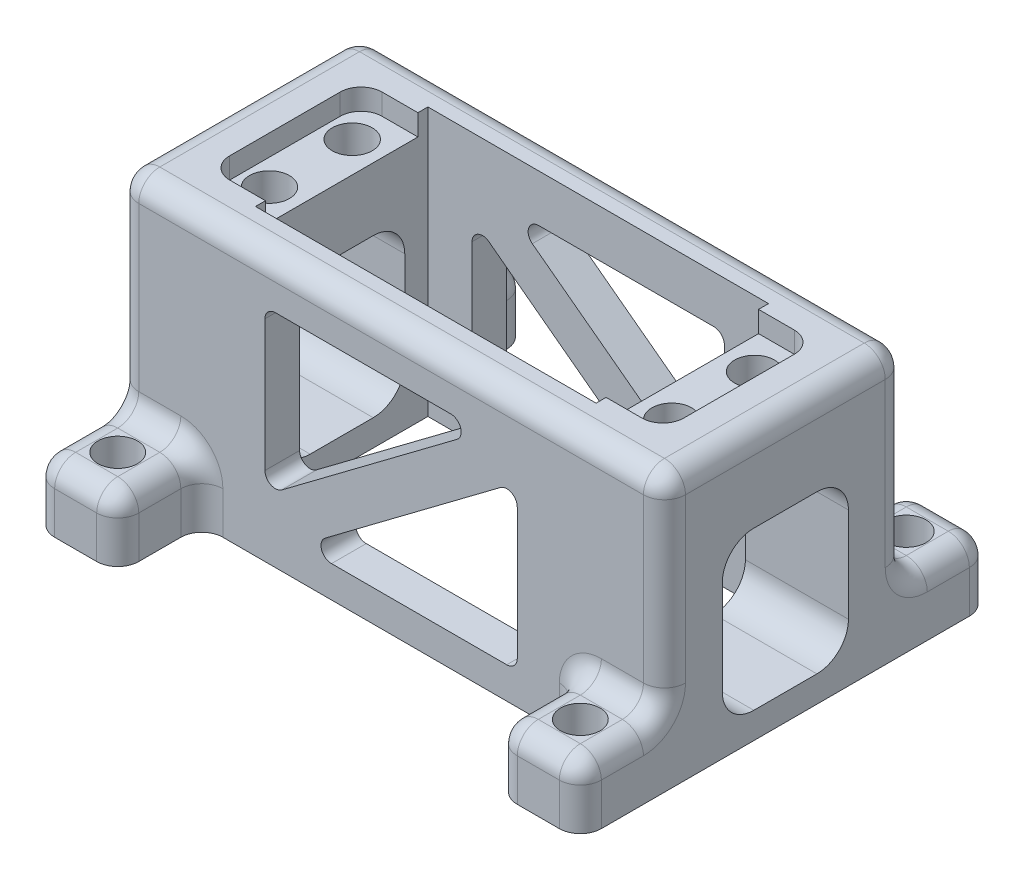
from build123d import *

# Parameters (mm, degrees)
SKETCH1_W           = 66.04
SKETCH1_H           = 29.21
SKETCH1_W_2         = 41.148
SKETCH1_H_2         = 20.828
BOSS_EXTRUDE1_DEPTH = 32.385
CUT_EXTRUDE1_DEPTH  = 2.54
SKETCH3_R           = 2.413
CUT_EXTRUDE2_DEPTH  = 10.16
SKETCH4_W           = 10.16
SKETCH4_H           = 10.16
BOSS_EXTRUDE2_DEPTH = 7.62
SKETCH5_R           = 2.3876
CUT_EXTRUDE3_DEPTH  = 53.463452517
FILLET1_R           = 2.54
CUT_EXTRUDE4_DEPTH  = 78.610405552
CUT_EXTRUDE5_REACH  = 62.738
CUT_EXTRUDE6_REACH  = 62.738


with BuildPart() as part:
    # Sketch1 → Boss-Extrude1 (new body)
    with BuildSketch(Plane(origin=(0, 0, 0), x_dir=(1, 0, 0), z_dir=(0, 1, 0))):
        Rectangle(SKETCH1_W, SKETCH1_H)
        Rectangle(SKETCH1_W_2, SKETCH1_H_2, mode=Mode.SUBTRACT)
    extrude(amount=BOSS_EXTRUDE1_DEPTH)

    # Sketch2 → Cut-Extrude1 (cut)
    with BuildSketch(Plane(origin=(0, 32.385, 0), x_dir=(1, 0, 0), z_dir=(0, 1, 0))):
        with BuildLine():
            Line((20.574, 9.2075), (24.892, 9.2075))
            ThreePointArc((24.892, 9.2075), (26.688051224, 8.463551224), (27.432, 6.6675))
            Line((27.432, 6.6675), (27.432, -6.6675))
            ThreePointArc((27.432, -6.6675), (26.688051224, -8.463551224), (24.892, -9.2075))
            Line((24.892, -9.2075), (20.574, -9.2075))
            Line((20.574, -9.2075), (20.574, 9.2075))
        make_face()
        with BuildLine():
            Line((-20.574, -9.2075), (-24.892, -9.2075))
            ThreePointArc((-24.892, -9.2075), (-26.688051224, -8.463551224), (-27.432, -6.6675))
            Line((-27.432, -6.6675), (-27.432, 6.6675))
            ThreePointArc((-27.432, 6.6675), (-26.688051224, 8.463551224), (-24.892, 9.2075))
            Line((-24.892, 9.2075), (-20.574, 9.2075))
            Line((-20.574, 9.2075), (-20.574, -9.2075))
        make_face()
    extrude(amount=-CUT_EXTRUDE1_DEPTH, mode=Mode.SUBTRACT)

    # Sketch3 → Cut-Extrude2 (cut)
    with BuildSketch(Plane(origin=(0, 29.845, 0), x_dir=(1, 0, 0), z_dir=(0, 1, 0))):
        with Locations((24.3, -5)):
            Circle(SKETCH3_R)
        with Locations((24.3, 5)):
            Circle(SKETCH3_R)
        with Locations((-24.3, -5)):
            Circle(SKETCH3_R)
        with Locations((-24.3, 5)):
            Circle(SKETCH3_R)
    extrude(amount=-CUT_EXTRUDE2_DEPTH, mode=Mode.SUBTRACT)

    # Sketch4 → Boss-Extrude2 (add)
    with BuildSketch(Plane.XZ):
        with Locations((-27.94, 19.685)):
            Rectangle(SKETCH4_W, SKETCH4_H)
        with Locations((27.94, 19.685)):
            Rectangle(SKETCH4_W, SKETCH4_H)
        with Locations((-27.94, -19.685)):
            Rectangle(SKETCH4_W, SKETCH4_H)
        with Locations((27.94, -19.685)):
            Rectangle(SKETCH4_W, SKETCH4_H)
    extrude(amount=-BOSS_EXTRUDE2_DEPTH)

    # Sketch5 → Cut-Extrude3 (cut, through all)
    with BuildSketch(Plane.XZ):
        with Locations((27.94, 19.685)):
            Circle(SKETCH5_R)
        with Locations((27.94, -19.685)):
            Circle(SKETCH5_R)
        with Locations((-27.94, -19.685)):
            Circle(SKETCH5_R)
        with Locations((-27.94, 19.685)):
            Circle(SKETCH5_R)
    extrude(amount=-CUT_EXTRUDE3_DEPTH, mode=Mode.SUBTRACT)

    # Fillet1
    fillet1_edges = [part.edges().sort_by_distance(p)[0] for p in [
        (22.86, 3.81, -14.605),
        (33.02, 7.62, -19.685),
        (-22.86, 3.81, -14.605),
        (-33.02, 7.62, 19.685),
        (33.02, 7.62, 19.685),
        (-33.02, 32.385, 0),
        (33.02, 32.385, 0),
        (33.02, 3.81, -24.765),
        (22.86, 3.81, -24.765),
        (22.86, 7.62, -19.685),
        (27.94, 7.62, -24.765),
        (27.94, 7.62, -14.605),
        (0, 32.385, -14.605),
        (33.02, 20.0025, -14.605),
        (-22.86, 3.81, -24.765),
        (-33.02, 3.81, -24.765),
        (-27.94, 7.62, -24.765),
        (-22.86, 7.62, -19.685),
        (-27.94, 7.62, -14.605),
        (-33.02, 7.62, -19.685),
        (-33.02, 20.0025, -14.605),
        (-22.86, 3.81, 24.765),
        (-33.02, 3.81, 24.765),
        (22.86, 3.81, 24.765),
        (33.02, 3.81, 24.765),
        (-27.94, 7.62, 24.765),
        (27.94, 7.62, 24.765),
        (22.86, 7.62, 19.685),
        (-22.86, 7.62, 19.685),
        (22.86, 3.81, 14.605),
        (-22.86, 3.81, 14.605),
        (-27.94, 7.62, 14.605),
        (27.94, 7.62, 14.605),
        (0, 32.385, 14.605),
        (33.02, 20.0025, 14.605),
        (-33.02, 20.0025, 14.605),
    ]]
    fillet(fillet1_edges, radius=FILLET1_R)

    # Sketch6 → Cut-Extrude4 (cut, through all)
    with BuildSketch(Plane(origin=(33.02, 0, 0), x_dir=(0, 0, -1), z_dir=(1, 0, 0))):
        with BuildLine():
            Line((-3.81, 22.225), (3.81, 22.225))
            ThreePointArc((3.81, 22.225), (6.504076836, 21.109076836), (7.62, 18.415))
            Line((7.62, 18.415), (7.62, 6.985))
            ThreePointArc((7.62, 6.985), (6.504076836, 4.290923164), (3.81, 3.175))
            Line((3.81, 3.175), (-3.81, 3.175))
            ThreePointArc((-3.81, 3.175), (-6.504076836, 4.290923164), (-7.62, 6.985))
            Line((-7.62, 6.985), (-7.62, 18.415))
            ThreePointArc((-7.62, 18.415), (-6.504076836, 21.109076836), (-3.81, 22.225))
        make_face()
    extrude(amount=-CUT_EXTRUDE4_DEPTH, mode=Mode.SUBTRACT)

    # Sketch9 → Cut-Extrude5 (cut, up to next)
    with BuildSketch(Plane(origin=(0, 0, -14.605), x_dir=(-1, 0, 0), z_dir=(0, 0, -1)), mode=Mode.PRIVATE) as cut_extrude5_sk1:
        with BuildLine():
            Line((-13.97, 26.67), (7.196666667, 26.67))
            ThreePointArc((7.196666667, 26.67), (8.401494455, 25.801609263), (7.958666667, 24.384))
            Line((7.958666667, 24.384), (-13.208, 8.509))
            ThreePointArc((-13.208, 8.509), (-14.537961266, 8.389077467), (-15.24, 9.525))
            Line((-15.24, 9.525), (-15.24, 25.4))
            ThreePointArc((-15.24, 25.4), (-14.868025612, 26.298025612), (-13.97, 26.67))
        make_face()
    cut_extrude5_tool1 = extrude(cut_extrude5_sk1.sketch, amount=-CUT_EXTRUDE5_REACH, mode=Mode.PRIVATE) & part.part
    # Sketch9 → Cut-Extrude5 (cut, up to next)
    with BuildSketch(Plane(origin=(0, 0, -14.605), x_dir=(-1, 0, 0), z_dir=(0, 0, -1)), mode=Mode.PRIVATE) as cut_extrude5_sk2:
        with BuildLine():
            Line((-7.196666667, 3.81), (13.97, 3.81))
            ThreePointArc((13.97, 3.81), (14.868025612, 4.181974388), (15.24, 5.08))
            Line((15.24, 5.08), (15.24, 20.955))
            ThreePointArc((15.24, 20.955), (14.537961266, 22.090922533), (13.208, 21.971))
            Line((13.208, 21.971), (-7.958666667, 6.096))
            ThreePointArc((-7.958666667, 6.096), (-8.401494455, 4.678390737), (-7.196666667, 3.81))
        make_face()
    cut_extrude5_tool2 = extrude(cut_extrude5_sk2.sketch, amount=-CUT_EXTRUDE5_REACH, mode=Mode.PRIVATE) & part.part
    add(cut_extrude5_tool1.solids().sort_by_distance((6.606961, 20.102283, -14.605))[0], mode=Mode.SUBTRACT)
    add(cut_extrude5_tool2.solids().sort_by_distance((-6.606961, 10.377717, -14.605))[0], mode=Mode.SUBTRACT)

    # Sketch10 → Cut-Extrude6 (cut, up to next)
    with BuildSketch(Plane.XY.offset(14.605), mode=Mode.PRIVATE) as cut_extrude6_sk1:
        with BuildLine():
            Line((7.196666667, 26.67), (-13.97, 26.67))
            ThreePointArc((-13.97, 26.67), (-14.868025612, 26.298025612), (-15.24, 25.4))
            Line((-15.24, 25.4), (-15.24, 9.525))
            ThreePointArc((-15.24, 9.525), (-14.537961266, 8.389077467), (-13.208, 8.509))
            Line((-13.208, 8.509), (7.958666667, 24.384))
            ThreePointArc((7.958666667, 24.384), (8.401494455, 25.801609263), (7.196666667, 26.67))
        make_face()
    cut_extrude6_tool1 = extrude(cut_extrude6_sk1.sketch, amount=-CUT_EXTRUDE6_REACH, mode=Mode.PRIVATE) & part.part
    # Sketch10 → Cut-Extrude6 (cut, up to next)
    with BuildSketch(Plane.XY.offset(14.605), mode=Mode.PRIVATE) as cut_extrude6_sk2:
        with BuildLine():
            ThreePointArc((-7.958666667, 6.096), (-8.401494455, 4.678390737), (-7.196666667, 3.81))
            Line((-7.196666667, 3.81), (13.97, 3.81))
            ThreePointArc((13.97, 3.81), (14.868025612, 4.181974388), (15.24, 5.08))
            Line((15.24, 5.08), (15.24, 20.955))
            ThreePointArc((15.24, 20.955), (14.537961266, 22.090922533), (13.208, 21.971))
            Line((13.208, 21.971), (-7.958666667, 6.096))
        make_face()
    cut_extrude6_tool2 = extrude(cut_extrude6_sk2.sketch, amount=-CUT_EXTRUDE6_REACH, mode=Mode.PRIVATE) & part.part
    add(cut_extrude6_tool1.solids().sort_by_distance((-6.606961, 20.102283, 14.605))[0], mode=Mode.SUBTRACT)
    add(cut_extrude6_tool2.solids().sort_by_distance((6.606961, 10.377717, 14.605))[0], mode=Mode.SUBTRACT)


solid = part.part
